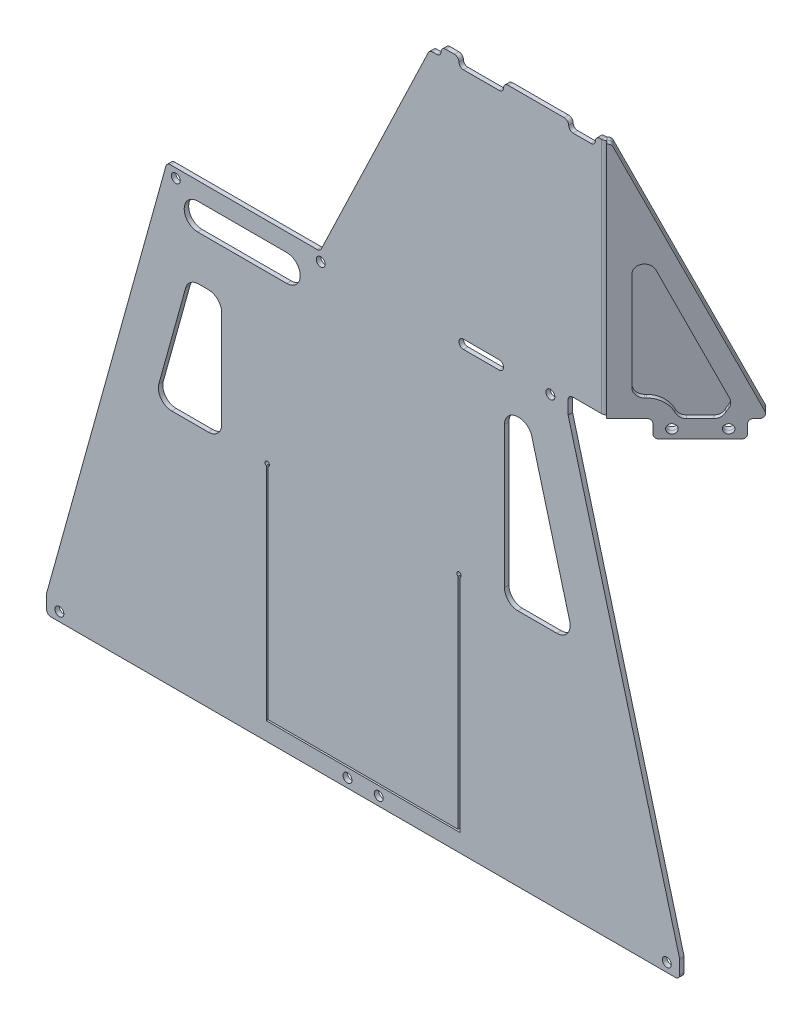
from build123d import *

# Parameters (mm, degrees)
SM_BASE_FLANGE_1_DEPTH      = 266.5
SM_BASE_FLANGE_1_DEPTH_BACK = 20
EXTRUDE_2_DEPTH             = 5
CUT_EXTRUDE_1_DEPTH         = 781.997587301
SKETCH_16_R                 = 5
CUT_EXTRUDE_6_DEPTH         = 804.201519225
CUT_EXTRUDE_7_DEPTH         = 780.82164677
SKETCH_18_W                 = 41.523044305
SKETCH_18_H                 = 20
SKETCH_18_R                 = 5
CUT_EXTRUDE_8_DEPTH         = 780.82164677
CUT_EXTRUDE_9_DEPTH         = 5
CUT_EXTRUDE_10_DEPTH        = 780.82164677
FILLET_1_R                  = 5
FILLET_2_R                  = 15
FILLET_3_R                  = 5
SKETCH_26_R                 = 5
EXTRUDE_3_DEPTH             = 5
FILLET_4_R                  = 10


# Sheet-metal steps are written as plain solids
with BuildPart() as part:
    # Sketch 1 → ﾍﾞｰｽ-ﾌﾗﾝｼﾞ1 (new, two sides: drawn at the far end of the back side and taken through both)
    with BuildSketch(Plane(origin=(0, 0, 0), x_dir=(1, 0, 0), z_dir=(0, 1, 0)).offset(-SM_BASE_FLANGE_1_DEPTH_BACK)):
        with BuildLine():
            Line((137.550775542, 90.408639918), (37.357880769, -9.784254855))
            ThreePointArc((37.357880769, -9.784254855), (37.11891053, -9.943929664), (36.837025914, -10))
            Line((36.837025914, -10), (30, -10))
            Line((30, -10), (-450.5, -10))
            Line((-450.5, -10), (-450.5, -15))
            Line((-450.5, -15), (30, -15))
            Line((30, -15), (36.837025914, -15))
            ThreePointArc((36.837025914, -15), (39.032327692, -14.563327326), (40.893414675, -13.319788761))
            Line((40.893414675, -13.319788761), (141.086309448, 86.873106012))
            Line((141.086309448, 86.873106012), (137.550775542, 90.408639918))
        make_face()
    extrude(amount=SM_BASE_FLANGE_1_DEPTH + SM_BASE_FLANGE_1_DEPTH_BACK)

    # ｽｹｯﾁ15 → ﾎﾞｽ - 押し出し2 (add)
    with BuildSketch(Plane.XY.offset(15)):
        Polygon((-450.5, 0), (-585.5, -486), (-585.5, -506), (124.5, -506), (124.5, -486), (-6, 0), align=None)
    extrude(amount=-EXTRUDE_2_DEPTH)

    # ｽｹｯﾁ7 → ｶｯﾄ - 押し出し1 (cut, through all)
    with BuildSketch(Plane.XY.offset(15)):
        Polygon((-278.755408603, 0), (-151.149515417, 266.5), (-450.5, 266.5), (-450.5, 0), align=None)
    extrude(amount=-CUT_EXTRUDE_1_DEPTH, mode=Mode.SUBTRACT)

    # ｽｹｯﾁ16 → ｶｯﾄ - 押し出し6 (cut, through all)
    with BuildSketch(Plane(origin=(27.106601718, 0, 27.106601718), x_dir=(0.7071067811865438, 0, -0.7071067811865513), z_dir=(0.7071067811865513, 0, 0.7071067811865438))):
        with BuildLine():
            Line((23.323748893, 266.5), (148.323748893, 0))
            Line((148.323748893, 0), (136.191648507, 0))
            ThreePointArc((136.191648507, 0), (132.656114601, -1.464466094), (131.191648507, -5))
            Line((131.191648507, -5), (131.191648507, -20))
            Line((131.191648507, -20), (141.191648507, -20))
            Line((141.191648507, -20), (161.191648507, -20))
            Line((161.191648507, -20), (161.191648507, 266.5))
            Line((161.191648507, 266.5), (23.323748893, 266.5))
        make_face()
        with BuildLine():
            Line((51.191648507, 0), (19.497497865, 0))
            Line((19.497497865, 0), (19.497497865, -20))
            Line((19.497497865, -20), (46.191648507, -20))
            Line((46.191648507, -20), (56.191648507, -20))
            Line((56.191648507, -20), (56.191648507, -5))
            ThreePointArc((56.191648507, -5), (54.727182413, -1.464466094), (51.191648507, 0))
        make_face()
        with Locations(Location((116.191648507, -10, 0), (0, 0, 180))):
            Circle(SKETCH_16_R)
        with Locations(Location((71.191648507, -10, 0), (0, 0, 180))):
            Circle(SKETCH_16_R)
    extrude(amount=-CUT_EXTRUDE_6_DEPTH, mode=Mode.SUBTRACT)

    # ｽｹｯﾁ17 → ｶｯﾄ - 押し出し7 (cut, through all)
    with BuildSketch(Plane.XY.offset(15)):
        with BuildLine():
            Line((-416.055555556, -20), (-316.055555556, -20))
            ThreePointArc((-316.055555556, -20), (-301.055555556, -35), (-316.055555556, -50))
            Line((-316.055555556, -50), (-416.055555556, -50))
            ThreePointArc((-416.055555556, -50), (-431.055555556, -35), (-416.055555556, -20))
        make_face()
    extrude(amount=-CUT_EXTRUDE_7_DEPTH, mode=Mode.SUBTRACT)

    # ｽｹｯﾁ18 → ｶｯﾄ - 押し出し8 (cut, through all)
    with BuildSketch(Plane.XY.offset(15)):
        with BuildLine():
            Line((-78, -5), (-118, -5))
            ThreePointArc((-118, -5), (-123, -10), (-118, -15))
            Line((-118, -15), (-78, -15))
            ThreePointArc((-78, -15), (-73, -10), (-78, -5))
        make_face()
        with BuildLine():
            Line((-123, 266.5), (-123, 261.5))
            ThreePointArc((-123, 261.5), (-121.535533906, 257.964466094), (-118, 256.5))
            Line((-118, 256.5), (-78, 256.5))
            ThreePointArc((-78, 256.5), (-74.464466094, 257.964466094), (-73, 261.5))
            Line((-73, 261.5), (-73, 266.5))
            Line((-73, 266.5), (-123, 266.5))
        make_face()
        with BuildLine():
            ThreePointArc((0, 261.5), (1.464466094, 257.964466094), (5, 256.5))
            Line((5, 256.5), (25, 256.5))
            ThreePointArc((25, 256.5), (28.535533906, 257.964466094), (30, 261.5))
            Line((30, 261.5), (30, 266.5))
            Line((30, 266.5), (0, 266.5))
            Line((0, 266.5), (0, 261.5))
        make_face()
        with BuildLine():
            Line((-143, 266.5), (-151.149515417, 266.5))
            Line((-151.149515417, 266.5), (-155.937729045, 256.5))
            Line((-155.937729045, 256.5), (-148, 256.5))
            ThreePointArc((-148, 256.5), (-144.464466094, 257.964466094), (-143, 261.5))
            Line((-143, 261.5), (-143, 266.5))
        make_face()
        with Locations((20.131892523, -10)):
            Rectangle(SKETCH_18_W, SKETCH_18_H)
        with Locations(Location((110, -496, 0), (0, 0, 180))):
            Circle(SKETCH_18_R)
        with Locations(Location((-571, -496, 0), (0, 0, 180))):
            Circle(SKETCH_18_R)
        with Locations(Location((-213, -496, 0), (0, 0, 180))):
            Circle(SKETCH_18_R)
        with Locations(Location((-248, -496, 0), (0, 0, 180))):
            Circle(SKETCH_18_R)
        with Locations(Location((-440.5, -10, 0), (0, 0, 180))):
            Circle(SKETCH_18_R)
        with Locations(Location((-20.5, -10, 0), (0, 0, 180))):
            Circle(SKETCH_18_R)
        with Locations(Location((-278, -10, 0), (0, 0, 180))):
            Circle(SKETCH_18_R)
    extrude(amount=-CUT_EXTRUDE_8_DEPTH, mode=Mode.SUBTRACT)

    # ｽｹｯﾁ24 → ｶｯﾄ - 押し出し9 (cut)
    with BuildSketch(Plane.XY.offset(15)):
        with BuildLine():
            ThreePointArc((-337, -238.291287847), (-338, -233.5), (-339, -238.291287847))
            Line((-339, -238.291287847), (-339, -486))
            Line((-339, -486), (-122, -486))
            Line((-122, -486), (-122, -238.291287847))
            ThreePointArc((-122, -238.291287847), (-123, -233.5), (-124, -238.291287847))
            Line((-124, -238.291287847), (-124, -484))
            Line((-124, -484), (-337, -484))
            Line((-337, -484), (-337, -238.291287847))
        make_face()
    extrude(amount=-CUT_EXTRUDE_9_DEPTH, mode=Mode.SUBTRACT)

    # ｽｹｯﾁ25 → ｶｯﾄ - 押し出し10 (cut, through all)
    with BuildSketch(Plane.XY.offset(15)):
        Polygon((-44.345258018, -50), (-72, -50), (-72, -238.291287847), (6.214439645, -238.291287847), align=None)
        Polygon((-389, -238.291287847), (-389, -100), (-426.38460641, -100), (-464.798853035, -238.291287847), align=None)
    extrude(amount=-CUT_EXTRUDE_10_DEPTH, mode=Mode.SUBTRACT)

    # ﾌｨﾚｯﾄ1
    fillet_1_edges = [part.edges().sort_by_distance(p)[0] for p in [
        (-0.62962963, 0, 12.5),
    ]]
    fillet(fillet_1_edges, radius=FILLET_1_R)

    # ﾌｨﾚｯﾄ2
    fillet_2_edges = [part.edges().sort_by_distance(p)[0] for p in [
        (-389, -238.291287847, 12.5),
        (-464.798853035, -238.291287847, 12.5),
        (-426.38460641, -100, 12.5),
        (-389, -100, 12.5),
        (-72, -238.291287847, 12.5),
        (-72, -50, 12.5),
        (-44.345258018, -50, 12.5),
        (6.214439645, -238.291287847, 12.5),
    ]]
    fillet(fillet_2_edges, radius=FILLET_2_R)

    # ﾌｨﾚｯﾄ3
    fillet_3_edges = [part.edges().sort_by_distance(p)[0] for p in [
        (-155.937729045, 256.5, 12.5),
        (-143, 266.5, 12.5),
        (-123, 266.5, 12.5),
        (-73, 266.5, 12.5),
        (0, 266.5, 12.5),
        (30, 266.5, 12.5),
        (41.831215769, 266.5, 8.84645376),
        (130.219563418, 0, -79.541893888),
        (118.105339059, -20, -67.42766953),
        (65.07233047, -20, -14.394660941),
        (124.5, -486, 12.5),
        (124.5, -506, 12.5),
        (-585.5, -506, 12.5),
        (-585.5, -486, 12.5),
        (-450.5, 0, 12.5),
        (-278.755408603, 0, 12.5),
    ]]
    fillet(fillet_3_edges, radius=FILLET_3_R - 0.0001)  # a hair under: the kernel refuses the full size


with BuildPart() as body_2:
    # ｽｹｯﾁ26 → ﾎﾞｽ - 押し出し3 (new body)
    with BuildSketch(Plane(origin=(27.106601718, 0, 27.106601718), x_dir=(0.7071067811865438, 0, -0.7071067811865513), z_dir=(0.7071067811865513, 0, 0.7071067811865438))):
        with BuildLine():
            Line((144.982633837, 7.123257298), (24.673065357, 263.623257298))
            ThreePointArc((24.673065357, 263.623257298), (22.828044537, 265.719969579), (20.146280798, 266.5))
            Line((20.146280798, 266.5), (19.497497865, 266.5))
            Line((19.497497865, 266.5), (19.497497865, 0))
            Line((19.497497865, 0), (51.191648507, 0))
            ThreePointArc((51.191648507, 0), (54.727182413, -1.464466094), (56.191648507, -5))
            Line((56.191648507, -5), (56.191648507, -15))
            ThreePointArc((56.191648507, -15), (57.656114601, -18.535533906), (61.191648507, -20))
            Line((61.191648507, -20), (126.191648507, -20))
            ThreePointArc((126.191648507, -20), (129.727182413, -18.535533906), (131.191648507, -15))
            Line((131.191648507, -15), (131.191648507, -5))
            ThreePointArc((131.191648507, -5), (132.656114601, -1.464466094), (136.191648507, 0))
            Line((136.191648507, 0), (140.455849278, 0))
            ThreePointArc((140.455849278, 0), (144.675818857, 2.31823626), (144.982633837, 7.123257298))
        make_face()
        with Locations((116.191648507, -10)):
            Circle(SKETCH_26_R, mode=Mode.SUBTRACT)
        with Locations((71.191648507, -10)):
            Circle(SKETCH_26_R, mode=Mode.SUBTRACT)
        with BuildLine():
            Line((119.746353698, 13.829558641), (39.497497865, 184.920119276))
            Line((39.497497865, 184.920119276), (39.497497865, 20))
            Line((39.497497865, 20), (51.191648507, 20))
            ThreePointArc((51.191648507, 20), (67.003036808, 14.364916731), (75.686545935, 0))
            Line((75.686545935, 0), (111.696751079, 0))
            ThreePointArc((111.696751079, 0), (114.58519095, 7.576207371), (119.746353698, 13.829558641))
        make_face(mode=Mode.SUBTRACT)
    extrude(amount=EXTRUDE_3_DEPTH)

    # ﾌｨﾚｯﾄ4
    fillet_4_edges = [body_2.edges().sort_by_distance(p)[0] for p in [
        (107.855898796, 0, -50.107161454),
        (113.547827393, 13.829558641, -55.799090051),
        (56.803317251, 184.920119276, 0.94542009),
        (56.803317251, 20, 0.94542009),
        (82.392838546, 0, -24.644101204),
    ]]
    fillet(fillet_4_edges, radius=FILLET_4_R)


solid = Compound([part.part, body_2.part])
